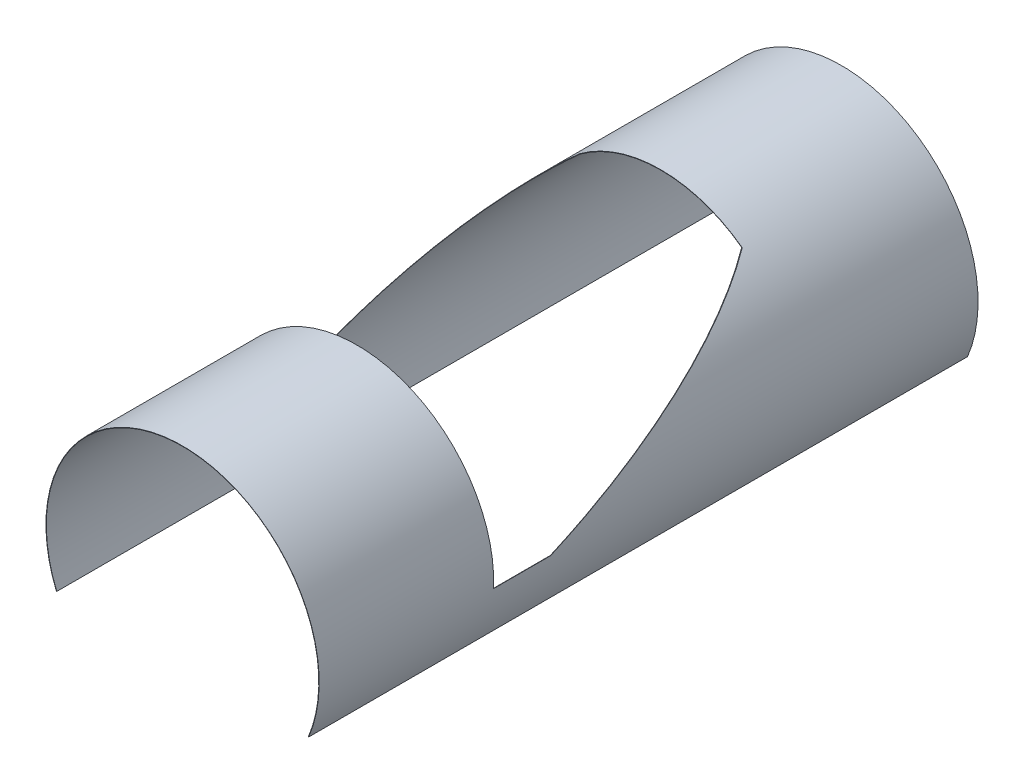
from build123d import *

# Parameters (mm, degrees)
SM_BASE_FLANGE_1_DEPTH   = 1963
CUT_EXTRUDE_1_DEPTH      = 2056.095688695
CUT_EXTRUDE_1_DEPTH_BACK = 2056.095688695


# Sheet-metal steps are written as plain solids
with BuildPart() as part:
    # Sketch 1 → Базовая кромка1 (new body)
    with BuildSketch(Plane.XY.offset(978.154266119)):
        with BuildLine():
            ThreePointArc((-78.935450432, 43.826476967), (295.859427587, 605.918755478), (670.654305605, 43.826476967))
            Line((670.654305605, 43.826476967), (671.577445699, 43.442013227))
            ThreePointArc((671.577445699, 43.442013227), (295.859427587, 606.918755478), (-79.858590526, 43.442013227))
            Line((-79.858590526, 43.442013227), (-78.935450432, 43.826476967))
        make_face()
    extrude(amount=-SM_BASE_FLANGE_1_DEPTH)

    # Эскиз6 → Вырез-Вытянуть1 (cut, two sides: drawn at the far end of the back side and taken through both)
    with BuildSketch(Plane(origin=(295.859427587, 199.918755478, 988), x_dir=(0, 0, -1), z_dir=(1, 0, 0)).offset(-CUT_EXTRUDE_1_DEPTH_BACK)):
        Polygon((529.845733881, 406.969134819), (529.845733881, -18.075276179), (699.845733881, -18.030865181), (1434.845733881, 326.969134819), (1434.845733881, 406.969134819), (1434.845733881, 592.56230864), (529.845733881, 592.56230864), align=None)
    extrude(amount=CUT_EXTRUDE_1_DEPTH + CUT_EXTRUDE_1_DEPTH_BACK, mode=Mode.SUBTRACT)


solid = part.part
